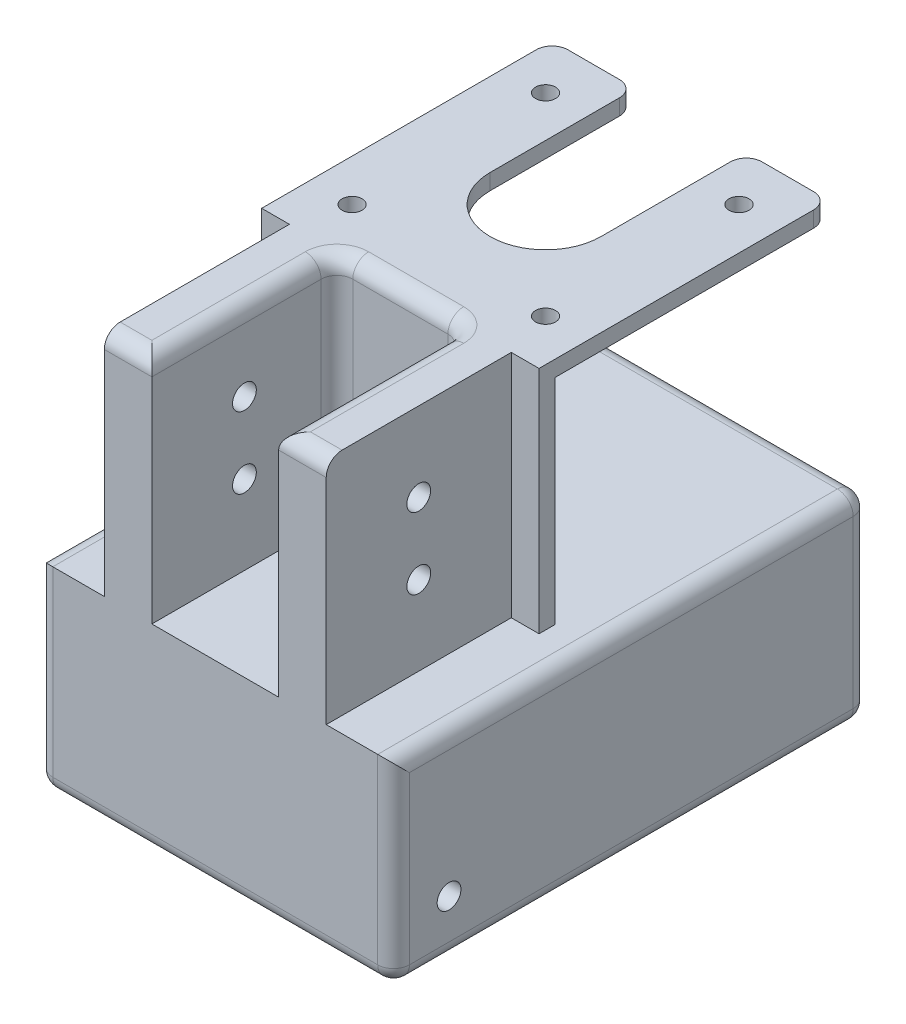
from build123d import *

# Parameters (mm, degrees)
SKETCH3_W                         = 57.15
SKETCH3_H                         = 76.2
BOSS_EXTRUDE2_DEPTH               = 31.75
SKETCH4_W                         = 49.53
SKETCH4_H                         = 68.58
CUT_EXTRUDE2_DEPTH                = 26.67
POWER_HOLE_REACH                  = 102.402
SKETCH5_W                         = 9.398
SKETCH5_H                         = 11.43
MOTOR_MOUNTING_SHAPE_DEPTH        = 57.15
MOTOR_MOUNTING_HOLES_REACH        = 119.37
SKETCH8_R                         = 1.6
SKETCH7_W                         = 7.62
SKETCH7_H                         = 29.66
TRAY_SUPPORT_MOUNTING_SHAPE_DEPTH = 36.83
SKETCH9_W                         = 20.32
SKETCH9_H                         = 12.7
CUT_EXTRUDE3_DEPTH                = 16.51
SKETCH10_W                        = 6.35
SKETCH10_H                        = 46.54
CUT_EXTRUDE4_DEPTH                = 36.83
SKETCH11_R                        = 1.905
CUT_EXTRUDE5_DEPTH                = 97.497020291
BIGBUTTONWIREHOLE_REACH           = 104.123
SKETCH12_R                        = 1.905
BOSS_EXTRUDE3_DEPTH               = 20.32
FILLET2_R                         = 2.54
FILLET1_R                         = 2.54


with BuildPart() as part:
    # Sketch3 → Boss-Extrude2 (new body)
    with BuildSketch(Plane(origin=(0, 0, 0), x_dir=(-1, 0, 0), z_dir=(0, 1, 0))):
        with Locations((28.575, 38.1)):
            Rectangle(SKETCH3_W, SKETCH3_H)
    extrude(amount=-BOSS_EXTRUDE2_DEPTH)

    # Sketch4 → Cut-Extrude2 (cut)
    with BuildSketch(Plane.XZ.offset(31.75)):
        with Locations((-28.575, 38.1)):
            Rectangle(SKETCH4_W, SKETCH4_H)
    extrude(amount=-CUT_EXTRUDE2_DEPTH, mode=Mode.SUBTRACT)

    # Sketch5 → Power Hole (cut, up to next)
    with BuildSketch(Plane(origin=(-57.15, 0, 0), x_dir=(0, 0, -1), z_dir=(1, 0, 0)), mode=Mode.PRIVATE) as power_hole_sk1:
        with Locations((-9.779, -22.225)):
            Rectangle(SKETCH5_W, SKETCH5_H)
    power_hole_tool1 = extrude(power_hole_sk1.sketch, amount=POWER_HOLE_REACH, mode=Mode.PRIVATE) & part.part
    add(power_hole_tool1.solids().sort_by_distance((-57.15, -22.225, 9.779))[0], mode=Mode.SUBTRACT)

    # Sketch6 → Motor Mounting Shape (add)
    with BuildSketch(Plane.ZY.offset(57.15)):
        Polygon((46.54, 0), (46.54, 36.83), (0, 36.83), (0, 34.29), (44, 34.29), (44, 0), align=None)
    extrude(amount=-MOTOR_MOUNTING_SHAPE_DEPTH)

    # Sketch8 → Motor-Mounting-Holes (cut, up to next)
    with BuildSketch(Plane(origin=(0, 36.83, 0), x_dir=(1, 0, 0), z_dir=(0, 1, 0)), mode=Mode.PRIVATE) as motor_mounting_holes_sk1:
        with Locations(Location((-44.075, -7.77, 0), (0, 0, 270))):
            Circle(SKETCH8_R)
    motor_mounting_holes_tool1 = extrude(motor_mounting_holes_sk1.sketch, amount=-MOTOR_MOUNTING_HOLES_REACH, mode=Mode.PRIVATE) & part.part
    # Sketch8 → Motor-Mounting-Holes (cut, up to next)
    with BuildSketch(Plane(origin=(0, 36.83, 0), x_dir=(1, 0, 0), z_dir=(0, 1, 0)), mode=Mode.PRIVATE) as motor_mounting_holes_sk2:
        with Locations(Location((-13.075, -7.77, 0), (0, 0, 270))):
            Circle(SKETCH8_R)
    motor_mounting_holes_tool2 = extrude(motor_mounting_holes_sk2.sketch, amount=-MOTOR_MOUNTING_HOLES_REACH, mode=Mode.PRIVATE) & part.part
    # Sketch8 → Motor-Mounting-Holes (cut, up to next)
    with BuildSketch(Plane(origin=(0, 36.83, 0), x_dir=(1, 0, 0), z_dir=(0, 1, 0)), mode=Mode.PRIVATE) as motor_mounting_holes_sk3:
        with Locations(Location((-13.075, -38.77, 0), (0, 0, 270))):
            Circle(SKETCH8_R)
    motor_mounting_holes_tool3 = extrude(motor_mounting_holes_sk3.sketch, amount=-MOTOR_MOUNTING_HOLES_REACH, mode=Mode.PRIVATE) & part.part
    # Sketch8 → Motor-Mounting-Holes (cut, up to next)
    with BuildSketch(Plane(origin=(0, 36.83, 0), x_dir=(1, 0, 0), z_dir=(0, 1, 0)), mode=Mode.PRIVATE) as motor_mounting_holes_sk4:
        with Locations(Location((-44.075, -38.77, 0), (0, 0, 270))):
            Circle(SKETCH8_R)
    motor_mounting_holes_tool4 = extrude(motor_mounting_holes_sk4.sketch, amount=-MOTOR_MOUNTING_HOLES_REACH, mode=Mode.PRIVATE) & part.part
    # Sketch8 → Motor-Mounting-Holes (cut, up to next)
    with BuildSketch(Plane(origin=(0, 36.83, 0), x_dir=(1, 0, 0), z_dir=(0, 1, 0)), mode=Mode.PRIVATE) as motor_mounting_holes_sk5:
        with BuildLine():
            Line((-37.465, 0), (-19.685, 0))
            Line((-19.685, 0), (-19.685, -23.27))
            ThreePointArc((-19.685, -23.27), (-28.575, -32.16), (-37.465, -23.27))
            Line((-37.465, -23.27), (-37.465, 0))
        make_face()
    motor_mounting_holes_tool5 = extrude(motor_mounting_holes_sk5.sketch, amount=-MOTOR_MOUNTING_HOLES_REACH, mode=Mode.PRIVATE) & part.part
    add(motor_mounting_holes_tool1.solids().sort_by_distance((-44.075, 36.83, 7.77))[0], mode=Mode.SUBTRACT)
    add(motor_mounting_holes_tool2.solids().sort_by_distance((-13.075, 36.83, 7.77))[0], mode=Mode.SUBTRACT)
    add(motor_mounting_holes_tool3.solids().sort_by_distance((-13.075, 36.83, 38.77))[0], mode=Mode.SUBTRACT)
    add(motor_mounting_holes_tool4.solids().sort_by_distance((-44.075, 36.83, 38.77))[0], mode=Mode.SUBTRACT)
    add(motor_mounting_holes_tool5.solids().sort_by_distance((-28.575, 36.83, 15.191166))[0], mode=Mode.SUBTRACT)

    # Sketch7 → Tray Support Mounting Shape (add)
    with BuildSketch(Plane(origin=(0, 0, 0), x_dir=(1, 0, 0), z_dir=(0, 1, 0))):
        with Locations((-42.545, -61.37)):
            Rectangle(SKETCH7_W, SKETCH7_H)
        with Locations((-14.605, -61.37)):
            Rectangle(SKETCH7_W, SKETCH7_H)
    extrude(amount=TRAY_SUPPORT_MOUNTING_SHAPE_DEPTH)

    # Sketch9 → Cut-Extrude3 (cut)
    with BuildSketch(Plane.XZ.offset(5.08)):
        with Locations((-28.575, 45.27)):
            Rectangle(SKETCH9_W, SKETCH9_H)
    extrude(amount=-CUT_EXTRUDE3_DEPTH, mode=Mode.SUBTRACT)

    # Sketch10 → Cut-Extrude4 (cut)
    with BuildSketch(Plane(origin=(0, 36.83, 0), x_dir=(1, 0, 0), z_dir=(0, 1, 0))):
        with Locations((-53.975, -23.27)):
            Rectangle(SKETCH10_W, SKETCH10_H)
        with Locations((-3.175, -23.27)):
            Rectangle(SKETCH10_W, SKETCH10_H)
    extrude(amount=-CUT_EXTRUDE4_DEPTH, mode=Mode.SUBTRACT)

    # Sketch11 → Cut-Extrude5 (cut, through all)
    with BuildSketch(Plane.ZY.offset(46.355)):
        with Locations((61.37, 24.13)):
            Circle(SKETCH11_R)
        with Locations((61.37, 12.7)):
            Circle(SKETCH11_R)
    extrude(amount=-CUT_EXTRUDE5_DEPTH, mode=Mode.SUBTRACT)

    # Sketch12 → BigButtonWireHole (cut, up to next)
    with BuildSketch(Plane(origin=(0, 0, 0), x_dir=(0, 0, -1), z_dir=(1, 0, 0)), mode=Mode.PRIVATE) as bigbuttonwirehole_sk1:
        with Locations((-67.31, -22.86)):
            Circle(SKETCH12_R)
    bigbuttonwirehole_tool1 = extrude(bigbuttonwirehole_sk1.sketch, amount=-BIGBUTTONWIREHOLE_REACH, mode=Mode.PRIVATE) & part.part
    add(bigbuttonwirehole_tool1.solids().sort_by_distance((0, -22.86, 67.31))[0], mode=Mode.SUBTRACT)

    # Sketch13 → Boss-Extrude3 (add)
    with BuildSketch(Plane(origin=(-38.735, 0, 0), x_dir=(0, 0, -1), z_dir=(1, 0, 0))):
        with BuildLine():
            Line((-46.54, 11.43), (-46.54, 15.24))
            ThreePointArc((-46.54, 15.24), (-52.826179285, 12.636179285), (-55.43, 6.35))
            Line((-55.43, 6.35), (-55.43, 0))
            Line((-55.43, 0), (-51.62, 0))
            Line((-51.62, 0), (-51.62, 6.35))
            ThreePointArc((-51.62, 6.35), (-50.132102448, 9.942102448), (-46.54, 11.43))
        make_face()
    extrude(amount=BOSS_EXTRUDE3_DEPTH)

    # Fillet2
    fillet2_edges = [part.edges().sort_by_distance(p)[0] for p in [
        (-18.415, 5.715, 44),
        (-38.735, 5.715, 44),
        (-28.575, 0, 38.92),
        (-18.415, 0.635, 51.62),
        (-38.735, 0.635, 51.62),
        (-28.575, 11.43, 44),
        (-38.735, -5.08, 45.27),
        (-28.575, -5.08, 38.92),
        (-18.415, -5.08, 45.27),
        (-28.575, -5.08, 51.62),
        (-38.735, 9.942102448, 50.132102448),
        (-18.415, 9.942102448, 50.132102448),
        (-38.735, 0, 41.46),
        (-18.415, 0, 41.46),
    ]]
    fillet(fillet2_edges, radius=FILLET2_R - 0.0001)  # a hair under: the kernel refuses the full size

    # Fillet1
    fillet1_edges = [part.edges().sort_by_distance(p)[0] for p in [
        (-38.735, 26.035, 46.54),
        (-42.545, 36.83, 76.2),
        (-38.735, 36.83, 61.37),
        (-18.415, 26.035, 46.54),
        (-18.415, 36.83, 61.37),
        (-14.605, 36.83, 76.2),
        (-57.15, -31.75, 38.1),
        (-28.575, -31.75, 76.2),
        (-50.8, 35.56, 0),
        (-6.35, 35.56, 0),
        (-28.575, 15.24, 46.54),
        (0, -31.75, 38.1),
        (-57.15, 0, 38.1),
        (-28.575, 0, 0),
        (0, 0, 38.1),
        (0, -15.875, 76.2),
        (-57.15, -15.875, 76.2),
        (-19.685, 35.56, 0),
        (-37.465, 35.56, 0),
        (-57.15, -15.875, 0),
        (0, -15.875, 0),
        (-28.575, -31.75, 0),
        (-28.575, 36.83, 46.54),
    ]]
    fillet(fillet1_edges, radius=FILLET1_R)


solid = part.part
